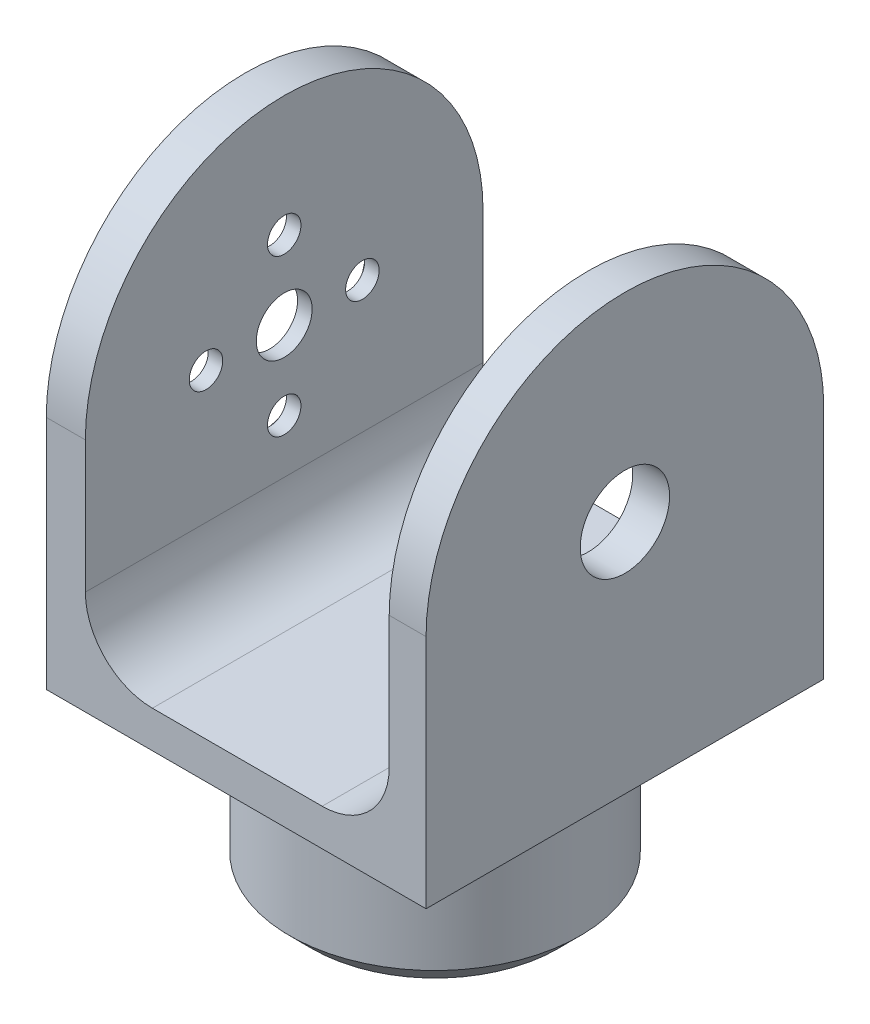
from build123d import *

# Parameters (mm, degrees)
SKETCH1_W               = 34
SKETCH1_H               = 35.6
BOSS_EXTRUDE1_DEPTH     = 3.3
BOSS_EXTRUDE2_DEPTH     = 3.5
BOSS_EXTRUDE3_START     = -30.7
BOSS_EXTRUDE3_DEPTH     = 3.3
SKETCH4_R               = 2.5
SKETCH4_R_2             = 1.5
CUT_EXTRUDE1_DEPTH      = 12
SKETCH4_3_R             = 10.925
SKETCH4_3_R_2           = 1.5
SKETCH4_3_R_3           = 2.5
CUT_EXTRUDE2_DEPTH      = 2.2
SKETCH5_R               = 4
CUT_EXTRUDE3_DEPTH      = 12.2
CUT_EXTRUDE4_DEPTH      = 47.033140236
CUT_EXTRUDE4_DEPTH_BACK = 47.033140236
SKETCH6_R               = 2.5
FILLET1_R               = 6
SKETCH7_R               = 13
SKETCH7_R_2             = 11
BOSS_EXTRUDE4_DEPTH     = 15
CHAMFER1_SIZE           = 2
FILLET2_R               = 3
SKETCH9_R               = 2.5
CUT_EXTRUDE5_DEPTH      = 15


with BuildPart() as part:
    # Sketch1 → Boss-Extrude1 (new body)
    with BuildSketch(Plane(origin=(0, 0, 0), x_dir=(1, 0, 0), z_dir=(0, 1, 0))):
        Rectangle(SKETCH1_W, SKETCH1_H)
    extrude(amount=BOSS_EXTRUDE1_DEPTH)

    # Sketch3 → Boss-Extrude2 (add)
    with BuildSketch(Plane.ZY.offset(17)):
        with BuildLine():
            Line((0, 38.9), (0, 3.3))
            Line((0, 3.3), (17.8, 3.3))
            Line((17.8, 3.3), (17.8, 21.1))
            ThreePointArc((17.8, 21.1), (12.586500705, 33.686500705), (0, 38.9))
        make_face()
        with BuildLine():
            Line((-17.8, 3.3), (0, 3.3))
            Line((0, 3.3), (0, 38.9))
            ThreePointArc((0, 38.9), (-12.586500705, 33.686500705), (-17.8, 21.1))
            Line((-17.8, 21.1), (-17.8, 3.3))
        make_face()
    extrude(amount=-BOSS_EXTRUDE2_DEPTH)

    # Sketch3<4> → Boss-Extrude3 (add)
    with BuildSketch(Plane.ZY.offset(17).offset(BOSS_EXTRUDE3_START)):
        with BuildLine():
            Line((-17.8, 3.3), (0, 3.3))
            Line((0, 3.3), (0, 38.9))
            ThreePointArc((0, 38.9), (-12.586500705, 33.686500705), (-17.8, 21.1))
            Line((-17.8, 21.1), (-17.8, 3.3))
        make_face()
        with BuildLine():
            Line((0, 38.9), (0, 3.3))
            Line((0, 3.3), (17.8, 3.3))
            Line((17.8, 3.3), (17.8, 21.1))
            ThreePointArc((17.8, 21.1), (12.586500705, 33.686500705), (0, 38.9))
        make_face()
    extrude(amount=-BOSS_EXTRUDE3_DEPTH)

    # Sketch4 → Cut-Extrude1 (cut)
    with BuildSketch(Plane.ZY.offset(17)):
        with Locations((0, 21.1)):
            Circle(SKETCH4_R)
        with Locations((7, 21.1)):
            Circle(SKETCH4_R_2)
        with Locations((0, 28.1)):
            Circle(SKETCH4_R_2)
        with Locations((-7, 21.1)):
            Circle(SKETCH4_R_2)
        with Locations((0, 14.1)):
            Circle(SKETCH4_R_2)
    extrude(amount=-CUT_EXTRUDE1_DEPTH, mode=Mode.SUBTRACT)

    # Sketch4<3> → Cut-Extrude2 (cut)
    with BuildSketch(Plane.ZY.offset(17)):
        with Locations((0, 21.1)):
            Circle(SKETCH4_3_R)
        with Locations((0, 28.1)):
            Circle(SKETCH4_3_R_2, mode=Mode.SUBTRACT)
        with Locations((0, 14.1)):
            Circle(SKETCH4_3_R_2, mode=Mode.SUBTRACT)
        with Locations((-7, 21.1)):
            Circle(SKETCH4_3_R_2, mode=Mode.SUBTRACT)
        with Locations((7, 21.1)):
            Circle(SKETCH4_3_R_2, mode=Mode.SUBTRACT)
        with Locations((0, 21.1)):
            Circle(SKETCH4_3_R_3, mode=Mode.SUBTRACT)
    extrude(amount=-CUT_EXTRUDE2_DEPTH, mode=Mode.SUBTRACT)

    # Sketch5 → Cut-Extrude3 (cut)
    with BuildSketch(Plane(origin=(17, 0, 0), x_dir=(0, 0, -1), z_dir=(1, 0, 0))):
        with Locations((0, 21.1)):
            Circle(SKETCH5_R)
    extrude(amount=-CUT_EXTRUDE3_DEPTH, mode=Mode.SUBTRACT)

    # Sketch6 → Cut-Extrude4 (cut, two sides: drawn at the far end of the back side and taken through both)
    with BuildSketch(Plane.XZ.offset(-CUT_EXTRUDE4_DEPTH_BACK)):
        with Locations(Location((0, 0, 0), (0, 0, 270))):
            Circle(SKETCH6_R)
    extrude(amount=CUT_EXTRUDE4_DEPTH + CUT_EXTRUDE4_DEPTH_BACK, mode=Mode.SUBTRACT)

    # Fillet1
    fillet1_edges = [part.edges().sort_by_distance(p)[0] for p in [
        (-13.5, 3.3, 0),
        (13.7, 3.3, 0),
    ]]
    fillet(fillet1_edges, radius=FILLET1_R)

    # Sketch7 → Boss-Extrude4 (add)
    with BuildSketch(Plane.XZ):
        with Locations(Location((0, 0, 0), (0, 0, 270))):
            Circle(SKETCH7_R)
        with Locations(Location((0, 0, 0), (0, 0, 270))):
            Circle(SKETCH7_R_2, mode=Mode.SUBTRACT)
    extrude(amount=BOSS_EXTRUDE4_DEPTH)

    # Chamfer1
    chamfer1_edges = [part.edges().sort_by_distance(p)[0] for p in [
        (0, -15, 13),
    ]]
    chamfer(chamfer1_edges, length=CHAMFER1_SIZE - 0.0001)  # a hair under: the kernel refuses the full size

    # Fillet2
    fillet2_edges = [part.edges().sort_by_distance(p)[0] for p in [
        (0, 0, 13),
    ]]
    fillet(fillet2_edges, radius=FILLET2_R)

    # Sketch9 → Cut-Extrude5 (cut)
    with BuildSketch(Plane(origin=(0, 0, -17.8), x_dir=(-1, 0, 0), z_dir=(0, 0, -1))):
        with Locations(Location((0, -2.5, 0), (0, 0, 90))):
            Circle(SKETCH9_R)
    extrude(amount=-CUT_EXTRUDE5_DEPTH, mode=Mode.SUBTRACT)


solid = part.part
